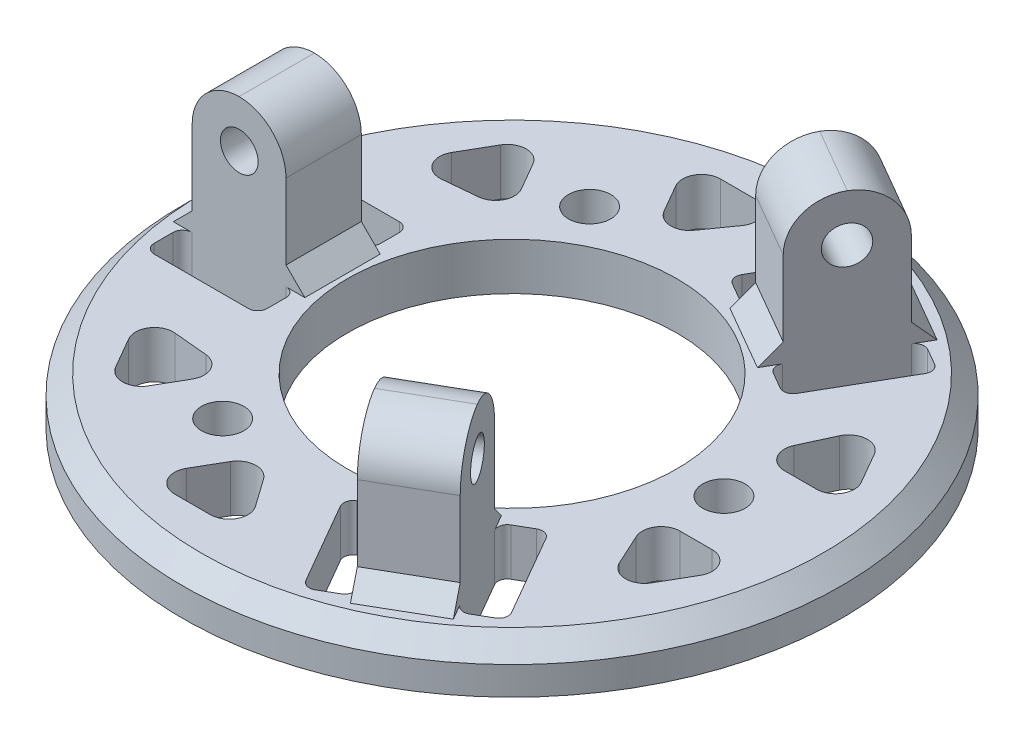
from build123d import *

# Parameters (mm, degrees)
SKETCH_1_R                       = 30
EXTRUDE_1_DEPTH                  = 5
SKETCH_2_R                       = 17.5
CUT_EXTRUDE_1_DEPTH              = 5
SKETCH_4_W                       = 3
SKETCH_4_H                       = 6
EXTRUDE_2_DEPTH                  = 4
FILLET_1_R                       = 2
SKETCH_5_R                       = 1.5
CUT_EXTRUDE_2_DEPTH              = 47.658332589
PATTERN_CIRCULAR_1_COUNT         = 3
FILLET_1_OF_PATTERN_CIRCULAR_1_R = 2
EXTRUDE_3_DEPTH                  = 8
PATTERN_CIRCULAR_2_COUNT         = 3
SKETCH_10_R                      = 35
SKETCH_10_R_2                    = 30
EXTRUDE_4_DEPTH                  = 5
SKETCH_11_W                      = 12
SKETCH_11_H                      = 4
CUT_EXTRUDE_3_DEPTH              = 8
PATTERN_CIRCULAR_3_COUNT         = 3
SKETCH_12_W                      = 12
SKETCH_12_H                      = 4
CUT_EXTRUDE_4_DEPTH              = 8
PATTERN_CIRCULAR_4_COUNT         = 3
FILLET_2_R                       = 1
FILLET_3_R                       = 1
CHAMFER_1_SIZE                   = 2
SKETCH_13_R                      = 2.4
CUT_EXTRUDE_5_DEPTH              = 8
PATTERN_CIRCULAR_7_COUNT         = 3
SKETCH_19_W                      = 88.76587097
SKETCH_19_H                      = 64.837679665
CUT_EXTRUDE_10_DEPTH             = 10
SKETCH_20_W                      = 9.964095652
SKETCH_20_H                      = 8
EXTRUDE_6_DEPTH                  = 15
FILLET_4_R                       = 5
SKETCH_21_R                      = 1.75
CUT_EXTRUDE_11_DEPTH             = 15
CHAMFER_2_SIZE                   = 2
PATTERN_START                    = -4
PATTERN_CIRCULAR_8_OUTLINE_R     = 1.75
PATTERN_CIRCULAR_8_DEPTH         = 8
PATTERN_CIRCULAR_8_2_OUTLINE_R   = 1.75
PATTERN_CIRCULAR_8_2_DEPTH       = 8
CUT_EXTRUDE_12_DEPTH             = 15
FILLET_5_R                       = 2
FILLET_6_R                       = 2
PATTERN_CIRCULAR_9_COUNT         = 3
FILLET_5_OF_PATTERN_CIRCULAR_9_R = 2
FILLET_6_OF_PATTERN_CIRCULAR_9_R = 2
SKETCH_23_R                      = 2.4
SKETCH_23_R_2                    = 2.25
EXTRUDE_7_DEPTH                  = 5
PATTERN_CIRCULAR_10_COUNT        = 3
SKETCH_24_R                      = 2.25
CUT_EXTRUDE_13_DEPTH             = 10
PATTERN_CIRCULAR_11_COUNT        = 3
EXTRUDE_START                    = -8
SKETCH_30_R                      = 2.25
SKETCH_30_R_2                    = 1.5
EXTRUDE_8_DEPTH                  = 8
SKETCH_31_R                      = 2.25
SKETCH_31_R_2                    = 1.5
EXTRUDE_9_DEPTH                  = 8
SKETCH_32_R                      = 2.25
SKETCH_32_R_2                    = 1.5
EXTRUDE_10_DEPTH                 = 8
SKETCH_33_R                      = 2
CUT_EXTRUDE_14_DEPTH             = 8
PATTERN_CIRCULAR_13_COUNT        = 3


# Read off the part's stored shape, not the designer's step: 阵列(圆周)8
with BuildPart() as part:
    # 草图1 → 凸台-拉伸1 (new body)
    with BuildSketch(Plane(origin=(0, 0, 0), x_dir=(1, 0, 0), z_dir=(0, 1, 0))):
        with Locations(Location((0, 0, 0), (0, 0, 270))):
            Circle(SKETCH_1_R)
    extrude(amount=EXTRUDE_1_DEPTH)

    # 草图2 → 切除-拉伸1 (cut)
    with BuildSketch(Plane(origin=(0, 5, 0), x_dir=(1, 0, 0), z_dir=(0, 1, 0))):
        with Locations(Location((0, 0, 0), (0, 0, 270))):
            Circle(SKETCH_2_R)
    extrude(amount=-CUT_EXTRUDE_1_DEPTH, mode=Mode.SUBTRACT)

    # 草图4 → 凸台-拉伸2 (add, symmetric)
    with BuildSketch(Plane.XY):
        with Locations((-26.5, 8)):
            Rectangle(SKETCH_4_W, SKETCH_4_H)
        with Locations((-23.5, 8)):
            Rectangle(SKETCH_4_W, SKETCH_4_H)
    extrude_2 = extrude(amount=EXTRUDE_2_DEPTH, both=True)

    # 圆角1
    fillet_1_edges = [part.edges().sort_by_distance(p)[0] for p in [
        (-28, 11, 0),
        (-22, 11, 0),
    ]]
    fillet(fillet_1_edges, radius=FILLET_1_R)

    # 草图5 → 切除-拉伸2 (cut, through all)
    with BuildSketch(Plane.XY.offset(4)):
        with Locations((-25, 8)):
            Circle(SKETCH_5_R)
    cut_extrude_2 = extrude(amount=-CUT_EXTRUDE_2_DEPTH, mode=Mode.SUBTRACT)

    # 阵列(圆周)1: 凸台-拉伸2, 切除-拉伸2 ×3 about axis
    pattern_circular_1_axis = Axis((0, 0, 0), (0, 1, 0))
    add([extrude_2.rotate(pattern_circular_1_axis, i * 360 / PATTERN_CIRCULAR_1_COUNT) for i in range(1, PATTERN_CIRCULAR_1_COUNT)])
    add([cut_extrude_2.rotate(pattern_circular_1_axis, i * 360 / PATTERN_CIRCULAR_1_COUNT) for i in range(1, PATTERN_CIRCULAR_1_COUNT)], mode=Mode.SUBTRACT)

    # 圆角1 of 阵列(圆周)1
    fillet_1_of_pattern_circular_1_edges = [part.edges().sort_by_distance(p)[0] for p in [
        (14, 11, 24.248711306),
        (11, 11, 19.052558883),
        (14, 11, -24.248711306),
        (11, 11, -19.052558883),
    ]]
    fillet(fillet_1_of_pattern_circular_1_edges, radius=FILLET_1_OF_PATTERN_CIRCULAR_1_R)

    # 草图7 → 凸台-拉伸3 (add)
    with BuildSketch(Plane(origin=(3.464101615, 0, -2), x_dir=(-0.500000000000004, 0, -0.8660254037844364), z_dir=(0.8660254037844365, 0, -0.500000000000004))):
        with BuildLine():
            Line((-22, 5), (-21, 5))
            Line((-21, 5), (-21, 9))
            ThreePointArc((-21, 9), (-21.878679656, 11.121320344), (-24, 12))
            Line((-24, 12), (-26, 12))
            ThreePointArc((-26, 12), (-28.121320344, 11.121320344), (-29, 9))
            Line((-29, 9), (-29, 5))
            Line((-29, 5), (-28, 5))
            Line((-28, 5), (-28, 9))
            ThreePointArc((-28, 9), (-27.414213562, 10.414213562), (-26, 11))
            Line((-26, 11), (-24, 11))
            ThreePointArc((-24, 11), (-22.585786438, 10.414213562), (-22, 9))
            Line((-22, 9), (-22, 5))
        make_face()
    extrude_3 = extrude(amount=-EXTRUDE_3_DEPTH)

    # 阵列(圆周)2: 凸台-拉伸3 ×3 about axis
    pattern_circular_2_axis = Axis((0, 0, 0), (0, 1, 0))
    for i in range(1, PATTERN_CIRCULAR_2_COUNT):
        add(extrude_3.rotate(pattern_circular_2_axis, i * 360 / PATTERN_CIRCULAR_2_COUNT))

    # 草图10 → 凸台-拉伸4 (add)
    with BuildSketch(Plane.XZ):
        with Locations(Location((0, 0, 0), (0, 0, 270))):
            Circle(SKETCH_10_R)
        Circle(SKETCH_10_R_2, mode=Mode.SUBTRACT)
    extrude(amount=-EXTRUDE_4_DEPTH)

    # 草图11 → 切除-拉伸3 (cut)
    with BuildSketch(Plane(origin=(0, 5, 0), x_dir=(1, 0, 0), z_dir=(0, 1, 0))):
        with Locations((-24.971570197, 6)):
            Rectangle(SKETCH_11_W, SKETCH_11_H)
    cut_extrude_3 = extrude(amount=-CUT_EXTRUDE_3_DEPTH, mode=Mode.SUBTRACT)

    # 阵列(圆周)3: 切除-拉伸3 ×3 about axis
    pattern_circular_3_axis = Axis((0, 0, 0), (0, 1, 0))
    for i in range(1, PATTERN_CIRCULAR_3_COUNT):
        add(cut_extrude_3.rotate(pattern_circular_3_axis, i * 360 / PATTERN_CIRCULAR_3_COUNT), mode=Mode.SUBTRACT)

    # 草图12 → 切除-拉伸4 (cut)
    with BuildSketch(Plane(origin=(0, 5, 0), x_dir=(1, 0, 0), z_dir=(0, 1, 0))):
        with Locations((-25.007474545, -6)):
            Rectangle(SKETCH_12_W, SKETCH_12_H)
    cut_extrude_4 = extrude(amount=-CUT_EXTRUDE_4_DEPTH, mode=Mode.SUBTRACT)

    # 阵列(圆周)4: 切除-拉伸4 ×3 about axis
    pattern_circular_4_axis = Axis((0, 0, 0), (0, 1, 0))
    for i in range(1, PATTERN_CIRCULAR_4_COUNT):
        add(cut_extrude_4.rotate(pattern_circular_4_axis, i * 360 / PATTERN_CIRCULAR_4_COUNT), mode=Mode.SUBTRACT)

    # 圆角2
    fillet_2_edges = [part.edges().sort_by_distance(p)[0] for p in [
        (-30.971570197, 2.5, -4),
        (-30.971570197, 2.5, -8),
        (-18.971570197, 2.5, -8),
        (-18.971570197, 2.5, -4),
        (-31.007474545, 2.5, 8),
        (-31.007474545, 2.5, 4),
        (-19.007474545, 2.5, 4),
        (-19.007474545, 2.5, 8),
    ]]
    fillet(fillet_2_edges, radius=FILLET_2_R)

    # 圆角3
    fillet_3_edges = [part.edges().sort_by_distance(p)[0] for p in [
        (18.949886714, 2.5, -24.822166586),
        (22.413988329, 2.5, -22.822166586),
        (16.413988329, 2.5, -12.42986174),
        (12.949886714, 2.5, -14.42986174),
        (12.021683483, 2.5, 28.822166586),
        (8.557581868, 2.5, 30.822166586),
        (2.557581868, 2.5, 20.42986174),
        (6.021683483, 2.5, 18.42986174),
        (8.575534042, 2.5, -30.853260663),
        (12.039635657, 2.5, -28.853260663),
        (6.039635657, 2.5, -18.460955817),
        (2.575534042, 2.5, -20.460955817),
        (22.431940503, 2.5, 22.853260663),
        (18.967838887, 2.5, 24.853260663),
        (12.967838887, 2.5, 14.460955817),
        (16.431940503, 2.5, 12.460955817),
    ]]
    fillet(fillet_3_edges, radius=FILLET_3_R)

    # 倒角1
    chamfer_1_edges = [part.edges().sort_by_distance(p)[0] for p in [
        (0, 5, 35),
    ]]
    chamfer(chamfer_1_edges, length=CHAMFER_1_SIZE)

    # 草图13 → 切除-拉伸5 (cut)
    with BuildSketch(Plane(origin=(0, 5, 0), x_dir=(1, 0, 0), z_dir=(0, 1, 0))):
        with Locations(Location((22.5, 0, 0), (0, 0, 270))):
            Circle(SKETCH_13_R)
    cut_extrude_5 = extrude(amount=-CUT_EXTRUDE_5_DEPTH, mode=Mode.SUBTRACT)

    # 阵列(圆周)7: 切除-拉伸5 ×3 about axis
    pattern_circular_7_axis = Axis((0, 0, 0), (0, 1, 0))
    for i in range(1, PATTERN_CIRCULAR_7_COUNT):
        add(cut_extrude_5.rotate(pattern_circular_7_axis, i * 360 / PATTERN_CIRCULAR_7_COUNT), mode=Mode.SUBTRACT)

    # 草图19 → 切除-拉伸10 (cut)
    with BuildSketch(Plane(origin=(0, 5, 0), x_dir=(1, 0, 0), z_dir=(0, 1, 0))):
        with Locations((1.350784993, -0.723634818)):
            Rectangle(SKETCH_19_W, SKETCH_19_H)
    extrude(amount=CUT_EXTRUDE_10_DEPTH, mode=Mode.SUBTRACT)

    # 草图20 → 凸台-拉伸6 (add)
    with BuildSketch(Plane(origin=(0, 5, 0), x_dir=(1, 0, 0), z_dir=(0, 1, 0))):
        with Locations((-24.989522371, 0)):
            Rectangle(SKETCH_20_W, SKETCH_20_H)
    extrude(amount=EXTRUDE_6_DEPTH)

    # 圆角4
    # the kernel refuses this fillet: 5 mm, written as the material it takes off along each edge
    with BuildSketch(Plane(origin=(-20.007474545, 20, -16.5), x_dir=(0, -1, 0), z_dir=(0, 0, 1)), Plane(origin=(-29.971570197, 20, 16.5), x_dir=(0, -1, 0), z_dir=(0, 0, -1))) as fillet_4_piece_1:
        with BuildLine():
            CenterArc((FILLET_4_R, -FILLET_4_R), FILLET_4_R, 90, 90)
            Line((0, -FILLET_4_R), (0, 0))
            Line((0, 0), (FILLET_4_R, 0))
        make_face()
    extrude(amount=33, mode=Mode.SUBTRACT)

    # 草图21 → 切除-拉伸11 (cut)
    with BuildSketch(Plane.XY.offset(4)):
        with Locations((-24.971570197, 15)):
            Circle(SKETCH_21_R)
    extrude(amount=-CUT_EXTRUDE_11_DEPTH, mode=Mode.SUBTRACT)

    # 倒角2
    # the kernel refuses this chamfer: 2 mm, written as the material it adds along each edge
    with BuildSketch(Plane(origin=(-29.971570197, 5, 4), x_dir=(-0.9996219169112968, -0.027495876610586462, 0), z_dir=(0, 0, -1)), Plane(origin=(-20.007474545, 5, -4), x_dir=(0.9996219169112968, -0.02749587661058651, 0), z_dir=(0, 0, 1))) as chamfer_2_piece_1:
        Polygon((CHAMFER_2_SIZE * 0.999621916911, CHAMFER_2_SIZE * 0.0274958766106), (-CHAMFER_2_SIZE * 0.0274958766106, CHAMFER_2_SIZE * 0.999621916911), (0, 0), align=None)
    extrude(amount=8)

    # 阵列(圆周)8 outline → 阵列(圆周)8 (add)
    with BuildSketch(Plane(origin=(0, 0, 0), x_dir=(0.500000000000004, 0, 0.8660254037844363), z_dir=(0.8660254037844363, 0, -0.5000000000000042)).offset(PATTERN_START)):
        with BuildLine():
            Line((29.971570197, -15), (29.971570197, -7))
            Line((29.971570197, -7), (31.971570197, -5))
            Line((31.971570197, -5), (18.007474545, -5))
            Line((18.007474545, -5), (20.007474545, -7))
            Line((20.007474545, -7), (20.007474545, -15))
            ThreePointArc((20.007474545, -15), (21.465599274, -18.529181147), (24.989522371, -19.999967772))
            ThreePointArc((24.989522371, -19.999967772), (28.513445468, -18.529181147), (29.971570197, -15))
        make_face()
        with Locations((24.971570197, -15)):
            Circle(PATTERN_CIRCULAR_8_OUTLINE_R, mode=Mode.SUBTRACT)
    extrude(amount=PATTERN_CIRCULAR_8_DEPTH)

    # Pattern Circular 8 2 outline → Pattern Circular 8 2 (add)
    with BuildSketch(Plane(origin=(0, 0, 0), x_dir=(0.49999999999999195, 0, -0.8660254037844434), z_dir=(0.8660254037844433, 0, 0.4999999999999921)).offset(PATTERN_START)):
        with BuildLine():
            Line((29.971570197, 7), (29.971570197, 15))
            ThreePointArc((29.971570197, 15), (28.513445468, 18.529181147), (24.989522371, 19.999967772))
            ThreePointArc((24.989522371, 19.999967772), (21.465599274, 18.529181147), (20.007474545, 15))
            Line((20.007474545, 15), (20.007474545, 7))
            Line((20.007474545, 7), (18.007474545, 5))
            Line((18.007474545, 5), (31.971570197, 5))
            Line((31.971570197, 5), (29.971570197, 7))
        make_face()
        with Locations((24.971570197, 15)):
            Circle(PATTERN_CIRCULAR_8_2_OUTLINE_R, mode=Mode.SUBTRACT)
    extrude(amount=PATTERN_CIRCULAR_8_2_DEPTH)

    # 草图22 → 切除-拉伸12 (cut)
    with BuildSketch(Plane(origin=(0, 5, 0), x_dir=(1, 0, 0), z_dir=(0, 1, 0))):
        Polygon((20.261774895, -5.547866936), (30.261774895, -5.547866936), (24.696793672, -15.186697158), align=None)
        Polygon((30.261774895, 5.547866936), (24.696793672, 15.186697158), (20.261774895, 5.547866936), align=None)
    cut_extrude_12 = extrude(amount=-CUT_EXTRUDE_12_DEPTH, mode=Mode.SUBTRACT)

    # 圆角5
    fillet_5_edges = [part.edges().sort_by_distance(p)[0] for p in [
        (24.696793672, 2.5, -15.186697158),
        (30.261774895, 2.5, -5.547866936),
        (20.261774895, 2.5, -5.547866936),
    ]]
    fillet(fillet_5_edges, radius=FILLET_5_R)

    # 圆角6
    fillet_6_edges = [part.edges().sort_by_distance(p)[0] for p in [
        (20.261774895, 2.5, 5.547866936),
        (30.261774895, 2.5, 5.547866936),
        (24.696793672, 2.5, 15.186697158),
    ]]
    fillet(fillet_6_edges, radius=FILLET_6_R)

    # 阵列(圆周)9: 切除-拉伸12 ×3 about axis
    pattern_circular_9_axis = Axis((0, 0, 0), (0, 1, 0))
    for i in range(1, PATTERN_CIRCULAR_9_COUNT):
        add(cut_extrude_12.rotate(pattern_circular_9_axis, i * 360 / PATTERN_CIRCULAR_9_COUNT), mode=Mode.SUBTRACT)

    # 圆角5 of 阵列(圆周)9
    fillet_5_of_pattern_circular_9_edges = [part.edges().sort_by_distance(p)[0] for p in [
        (-25.500462374, 2.5, -13.794702133),
        (-19.935481151, 2.5, -23.433532355),
        (-14.935481151, 2.5, -14.773278317),
        (0.803668702, 2.5, 28.981399291),
        (-10.326293745, 2.5, 28.981399291),
        (-5.326293745, 2.5, 20.321145253),
    ]]
    fillet(fillet_5_of_pattern_circular_9_edges, radius=FILLET_5_OF_PATTERN_CIRCULAR_9_R)

    # 圆角6 of 阵列(圆周)9
    fillet_6_of_pattern_circular_9_edges = [part.edges().sort_by_distance(p)[0] for p in [
        (-5.326293745, 2.5, -20.321145253),
        (-10.326293745, 2.5, -28.981399291),
        (0.803668702, 2.5, -28.981399291),
        (-14.935481151, 2.5, 14.773278317),
        (-19.935481151, 2.5, 23.433532355),
        (-25.500462374, 2.5, 13.794702133),
    ]]
    fillet(fillet_6_of_pattern_circular_9_edges, radius=FILLET_6_OF_PATTERN_CIRCULAR_9_R)

    # 草图23 → 凸台-拉伸7 (add)
    with BuildSketch(Plane(origin=(0, 5, 0), x_dir=(1, 0, 0), z_dir=(0, 1, 0))):
        with Locations((-11.25, -19.485571585)):
            Circle(SKETCH_23_R)
        with Locations(Location((-11.25, -19.485571585, 0), (0, 0, 270))):
            Circle(SKETCH_23_R_2, mode=Mode.SUBTRACT)
    extrude_7 = extrude(amount=-EXTRUDE_7_DEPTH)

    # 阵列(圆周)10: 凸台-拉伸7 ×3 about axis
    pattern_circular_10_axis = Axis((0, 0, 0), (0, 1, 0))
    for i in range(1, PATTERN_CIRCULAR_10_COUNT):
        add(extrude_7.rotate(pattern_circular_10_axis, i * 360 / PATTERN_CIRCULAR_10_COUNT))

    # 草图24 → 切除-拉伸13 (cut)
    with BuildSketch(Plane(origin=(-3.464101615, 0, 2), x_dir=(0.500000000000004, 0, 0.8660254037844364), z_dir=(-0.8660254037844365, 0, 0.500000000000004))):
        with Locations((24.971570197, 15)):
            Circle(SKETCH_24_R)
    cut_extrude_13 = extrude(amount=-CUT_EXTRUDE_13_DEPTH, mode=Mode.SUBTRACT)

    # 阵列(圆周)11: 切除-拉伸13 ×3 about axis
    pattern_circular_11_axis = Axis((0, 0, 0), (0, 1, 0))
    for i in range(1, PATTERN_CIRCULAR_11_COUNT):
        add(cut_extrude_13.rotate(pattern_circular_11_axis, i * 360 / PATTERN_CIRCULAR_11_COUNT), mode=Mode.SUBTRACT)

    # 草图30 → 凸台-拉伸8 (add)
    with BuildSketch(Plane.XY.offset(4).offset(EXTRUDE_START)):
        with Locations((-24.971570197, 15)):
            Circle(SKETCH_30_R)
        with Locations((-24.971570197, 15)):
            Circle(SKETCH_30_R_2, mode=Mode.SUBTRACT)
    extrude(amount=EXTRUDE_8_DEPTH)

    # 草图31 → 凸台-拉伸9 (add)
    with BuildSketch(Plane(origin=(-3.464101615, 0, 2), x_dir=(0.500000000000004, 0, 0.8660254037844364), z_dir=(-0.8660254037844365, 0, 0.500000000000004))):
        with Locations((24.971570197, 15)):
            Circle(SKETCH_31_R)
        with Locations((24.971570197, 15)):
            Circle(SKETCH_31_R_2, mode=Mode.SUBTRACT)
    extrude(amount=-EXTRUDE_9_DEPTH)

    # 草图32 → 凸台-拉伸10 (add)
    with BuildSketch(Plane(origin=(-3.464101615, 0, -2), x_dir=(-0.49999999999999195, 0, 0.8660254037844434), z_dir=(-0.8660254037844434, 0, -0.49999999999999195)).offset(EXTRUDE_START)):
        with Locations((-24.971570197, 15)):
            Circle(SKETCH_32_R)
        with Locations((-24.971570197, 15)):
            Circle(SKETCH_32_R_2, mode=Mode.SUBTRACT)
    extrude(amount=EXTRUDE_10_DEPTH)

    # 草图33 → 切除-拉伸14 (cut)
    with BuildSketch(Plane(origin=(-3.464101615, 0, 2), x_dir=(0.500000000000004, 0, 0.8660254037844364), z_dir=(-0.8660254037844365, 0, 0.500000000000004))):
        with Locations((24.971570197, 15)):
            Circle(SKETCH_33_R)
    cut_extrude_14 = extrude(amount=-CUT_EXTRUDE_14_DEPTH, mode=Mode.SUBTRACT)

    # 阵列(圆周)13: 切除-拉伸14 ×3 about axis
    pattern_circular_13_axis = Axis((0, 0, 0), (0, 1, 0))
    for i in range(1, PATTERN_CIRCULAR_13_COUNT):
        add(cut_extrude_14.rotate(pattern_circular_13_axis, i * 360 / PATTERN_CIRCULAR_13_COUNT), mode=Mode.SUBTRACT)


solid = part.part
